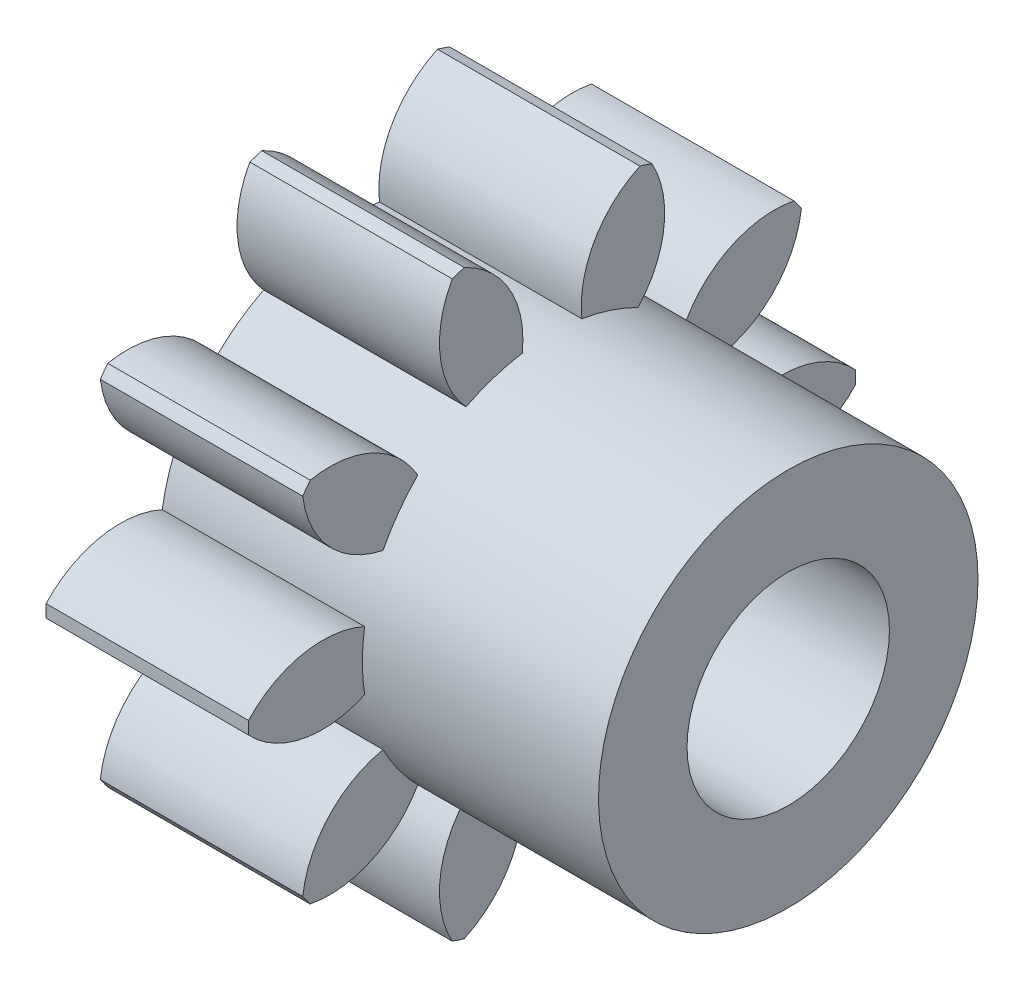
from build123d import *

# Parameters (mm, degrees)
BASPROSKE_W         = 6
BASPROSKE_H         = 9
TOOTHCUT_DEPTH      = 15.071247279
TEETHCUTS_COUNT     = 10
TEETHCUTS_ANGLE     = 324
BORSKE_R            = 3
BORE_DEPTH          = 50.0000508
SKETCH1_R           = 3
BOSS_EXTRUDE1_DEPTH = 7


with BuildPart() as part:
    # BasProSke → Base-Revolve (revolve)
    with BuildSketch(Plane(origin=(0, 0, 0), x_dir=(1, 0, 0), z_dir=(0, 1, 0))):
        with Locations((3, 4.5)):
            Rectangle(BASPROSKE_W, BASPROSKE_H)
    revolve(axis=Axis((-10, 0, 0), (1, 0, 0)))

    # TooCutSke → ToothCut (cut, through all)
    with BuildSketch(Plane(origin=(0, 0, 0), x_dir=(0, 0, -1), z_dir=(1, 0, 0))):
        with BuildLine():
            ThreePointArc((0.883878355, 5.554109745), (0, 5.624), (-0.883878355, 5.554109745))
            ThreePointArc((-0.883878355, 5.554109745), (-1.258245767, 7.379188248), (-2.637816971, 8.631324741))
            ThreePointArc((-2.637816971, 8.631324741), (0, 9.0254), (2.637816971, 8.631324741))
            ThreePointArc((2.637816971, 8.631324741), (1.258245767, 7.379188248), (0.883878355, 5.554109745))
        make_face()
    toothcut = extrude(amount=TOOTHCUT_DEPTH, mode=Mode.SUBTRACT)

    # TeethCuts: ToothCut ×10 about axis
    teethcuts_axis = Axis((-10, 0, 0), (1, 0, 0))
    for i in range(1, TEETHCUTS_COUNT):
        add(toothcut.rotate(teethcuts_axis, i * TEETHCUTS_ANGLE / (TEETHCUTS_COUNT - 1)), mode=Mode.SUBTRACT)

    # BorSke → Bore (cut, symmetric)
    with BuildSketch(Plane(origin=(0, 0, 0), x_dir=(0, 0, -1), z_dir=(1, 0, 0))):
        Circle(BORSKE_R)
    extrude(amount=BORE_DEPTH, both=True, mode=Mode.SUBTRACT)

    # Sketch1 → Boss-Extrude1 (add)
    with BuildSketch(Plane(origin=(6, 0, 0), x_dir=(0, 0, -1), z_dir=(1, 0, 0))):
        with BuildLine():
            ThreePointArc((5.555405697, -0.875696031), (5.6068252, -0.439189229), (5.624, 0))
            ThreePointArc((5.624, 0), (5.6068252, 0.439189229), (5.555405697, 0.875696031))
            ThreePointArc((5.555405697, 0.875696031), (5.348741848, 1.737911576), (5.009138832, 2.556932568))
            ThreePointArc((5.009138832, 2.556932568), (4.549911576, 3.305704259), (3.979696407, 3.97383851))
            ThreePointArc((3.979696407, 3.97383851), (3.305704259, 4.549911576), (2.549551188, 5.012899834))
            ThreePointArc((2.549551188, 5.012899834), (1.737911576, 5.348741848), (0.883878355, 5.554109745))
            ThreePointArc((0.883878355, 5.554109745), (0, 5.624), (-0.883878355, 5.554109745))
            ThreePointArc((-0.883878355, 5.554109745), (-1.737911576, 5.348741848), (-2.549551188, 5.012899834))
            ThreePointArc((-2.549551188, 5.012899834), (-3.305704259, 4.549911576), (-3.979696407, 3.97383851))
            ThreePointArc((-3.979696407, 3.97383851), (-4.549911576, 3.305704259), (-5.009138832, 2.556932568))
            ThreePointArc((-5.009138832, 2.556932568), (-5.348741848, 1.737911576), (-5.555405697, 0.875696031))
            ThreePointArc((-5.555405697, 0.875696031), (-5.624, 0), (-5.555405697, -0.875696031))
            ThreePointArc((-5.555405697, -0.875696031), (-5.348741848, -1.737911576), (-5.009138832, -2.556932568))
            ThreePointArc((-5.009138832, -2.556932568), (-4.549911576, -3.305704259), (-3.979696407, -3.97383851))
            ThreePointArc((-3.979696407, -3.97383851), (-3.305704259, -4.549911576), (-2.549551188, -5.012899834))
            ThreePointArc((-2.549551188, -5.012899834), (-1.737911576, -5.348741848), (-0.883878355, -5.554109745))
            ThreePointArc((-0.883878355, -5.554109745), (0, -5.624), (0.883878355, -5.554109745))
            ThreePointArc((0.883878355, -5.554109745), (1.737911576, -5.348741848), (2.549551188, -5.012899834))
            ThreePointArc((2.549551188, -5.012899834), (3.305704259, -4.549911576), (3.979696407, -3.97383851))
            ThreePointArc((3.979696407, -3.97383851), (4.549911576, -3.305704259), (5.009138832, -2.556932568))
            ThreePointArc((5.009138832, -2.556932568), (5.348741848, -1.737911576), (5.555405697, -0.875696031))
        make_face()
        Circle(SKETCH1_R, mode=Mode.SUBTRACT)
    extrude(amount=BOSS_EXTRUDE1_DEPTH)


solid = part.part
